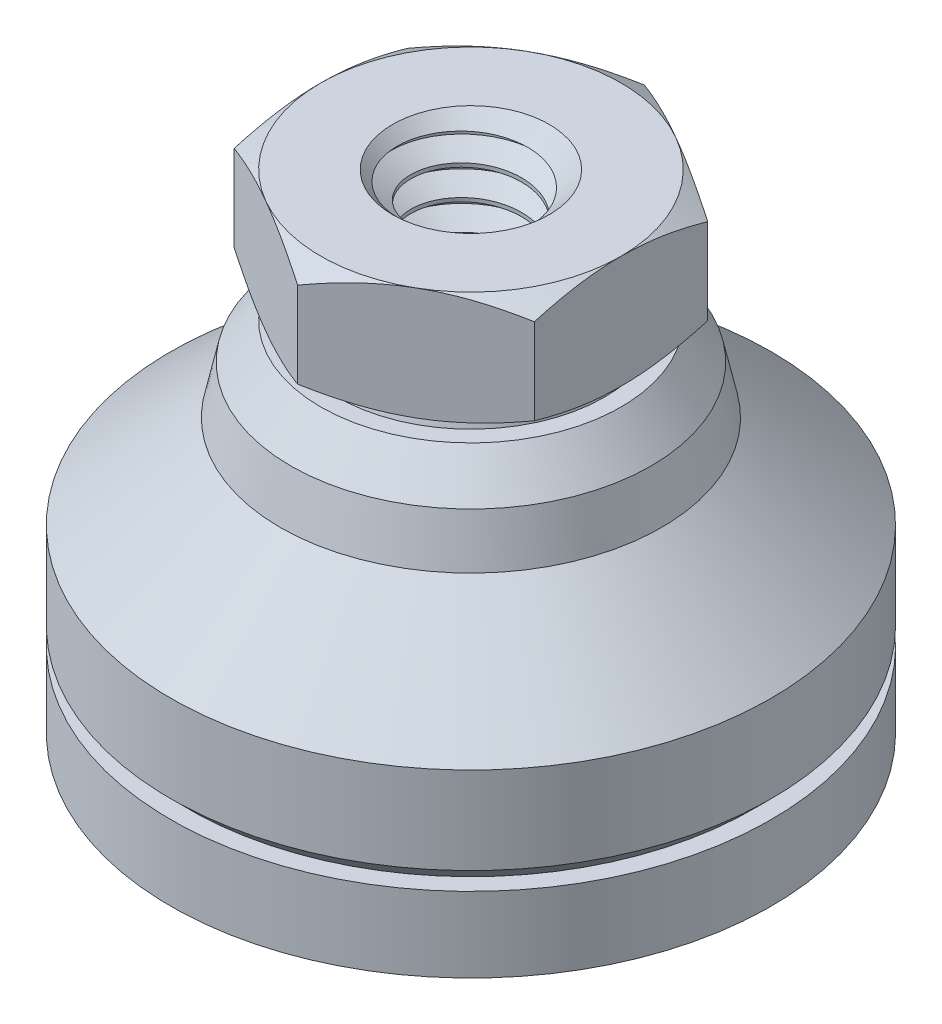
from build123d import *

# Parameters (mm, degrees)
BOSS_EXTRUDE1_DEPTH          = 4.7625
SKETCH5_R                    = 3.175
CUT_EXTRUDE1_DEPTH           = 7.9375
SWEEP1_PITCH                 = 1.27
SKETCH8_R                    = 3.312481533
CUT_EXTRUDE2_OTHER_WAY_DEPTH = 26.050327468
CUT_EXTRUDE2_OTHER_WAY_TAPER = -45
SKETCH11_W                   = 12.7
SKETCH11_H                   = 3.175


with BuildPart() as part:
    # Sketch2 → Revolve1 (revolve)
    with BuildSketch(Plane.XY, mode=Mode.PRIVATE) as revolve1_sk:
        with BuildLine():
            Line((0, 3.175), (0, 7.747))
            ThreePointArc((0, 7.747), (-4.638543521, 10.037538611), (-5.639715241, 15.113))
            Line((-5.639715241, 15.113), (-6.35, 15.113))
            Line((-6.35, 15.113), (-7.62, 13.589))
            Line((-7.62, 13.589), (-8.0645, 11.557))
            Line((-8.0645, 11.557), (-12.7, 7.62))
            Line((-12.7, 7.62), (-12.7, 3.937))
            Line((-12.7, 3.937), (-11.938, 3.175))
            Line((-11.938, 3.175), (0, 3.175))
        make_face()
    revolve(revolve1_sk.sketch.rotate(Axis((0, 0, 0), (0, 1, 0)), 270), axis=Axis((0, 0, 0), (0, 1, 0)))


with BuildPart() as body_2:
    # Sketch10 → Revolve2 (revolve)
    with BuildSketch(Plane.XY):
        with BuildLine():
            Line((0, 15.875), (-5.376166664, 15.875))
            ThreePointArc((-5.376166664, 15.875), (-4.872564828, 10.366101305), (0, 7.747))
            Line((0, 7.747), (0, 15.875))
        make_face()
    revolve(axis=Axis((0, 7.747, 0), (0, 1, 0)))

    # Sketch3 → Boss-Extrude1 (add)
    with BuildSketch(Plane(origin=(0, 15.875, 0), x_dir=(1, 0, 0), z_dir=(0, 1, 0))):
        Polygon((0, 7.332348419), (-6.35, 3.666174209), (-6.35, -3.666174209), (0, -7.332348419), (6.35, -3.666174209), (6.35, 3.666174209), align=None)
    extrude(amount=BOSS_EXTRUDE1_DEPTH)

    # Sketch4 → Cut-Revolve2 (revolve, cut)
    with BuildSketch(Plane(origin=(0, 0, 0), x_dir=(0, 0, -1), z_dir=(1, 0, 0)), mode=Mode.PRIVATE) as cut_revolve2_sk:
        Polygon((-8.314696837, 20.6375), (-8.314696837, 15.875), (-6.35, 15.875), (-7.332348419, 16.442159124), (-7.332348419, 20.070340876), (-6.35, 20.6375), align=None)
    revolve(cut_revolve2_sk.sketch.rotate(Axis((0, 0, 0), (0, 1, 0)), 270), axis=Axis((0, 0, 0), (0, 1, 0)), mode=Mode.SUBTRACT)

    # Sketch5 → Cut-Extrude1 (cut)
    with BuildSketch(Plane(origin=(0, 20.6375, 0), x_dir=(1, 0, 0), z_dir=(0, 1, 0))):
        with Locations(Location((0, 0, 0), (0, 0, 270))):
            Circle(SKETCH5_R)
    extrude(amount=-CUT_EXTRUDE1_DEPTH, mode=Mode.SUBTRACT)

    # Sweep1: the profile of Sketch7 screwed along a right-hand helix of 7.25 turns, 8 arcs to a turn; built about Z, then put on its axis
    sweep1_z = Axis((0, 0, 0), (0, 0, 1))
    sweep1_corners = [(3.243740766, 0, -1.1509375), (2.350110803, 0, -0.635), (2.350110803, 0, -0.47625), (3.243740766, 0, 0.0396875)]
    with BuildLine(mode=Mode.PRIVATE) as sweep1_profile:
        Line(sweep1_corners[0], sweep1_corners[1])
        Line(sweep1_corners[1], sweep1_corners[2])
        Line(sweep1_corners[2], sweep1_corners[3])
        Line(sweep1_corners[3], sweep1_corners[0])
    sweep1_cap = Face(sweep1_profile.wire())
    sweep1_turn_angles = [0, 22.5, 45, 67.5, 90, 112.5, 135, 157.5, 180, 202.5, 225, 247.5, 270, 292.5, 315, 337.5, 360]
    sweep1_turn_weights = [1, 0.9238795325112867, 1, 0.9238795325112867, 1, 0.9238795325112867, 1, 0.9238795325112867, 1, 0.9238795325112867, 1, 0.9238795325112867, 1, 0.9238795325112867, 1, 0.9238795325112867, 1]
    sweep1_turn_rails = [Edge.make_bspline([Vector(p[0], p[1], 0).rotate(sweep1_z, sweep1_turn_angles[k]) / sweep1_turn_weights[k] + Vector(0, 0, p[2] + SWEEP1_PITCH * sweep1_turn_angles[k] / 360) for k in range(17)], [0, 0, 0, 1, 1, 2, 2, 3, 3, 4, 4, 5, 5, 6, 6, 7, 7, 8, 8, 8], 2, sweep1_turn_weights) for p in sweep1_corners]
    sweep1_turn_sides = [Face.make_surface_from_curves(sweep1_turn_rails[p[0]], sweep1_turn_rails[p[1]]) for p in [(0, 1), (1, 2), (2, 3), (3, 0)]]
    sweep1_last_angles = [2520, 2542.5, 2565, 2587.5, 2610]
    sweep1_last_weights = [1, 0.9238795325112867, 1, 0.9238795325112701, 1]
    sweep1_last_rails = [Edge.make_bspline([Vector(p[0], p[1], 0).rotate(sweep1_z, sweep1_last_angles[k]) / sweep1_last_weights[k] + Vector(0, 0, p[2] + SWEEP1_PITCH * sweep1_last_angles[k] / 360) for k in range(5)], [0, 0, 0, 1, 1, 2, 2, 2], 2, sweep1_last_weights) for p in sweep1_corners]
    sweep1_last_sides = [Face.make_surface_from_curves(sweep1_last_rails[p[0]], sweep1_last_rails[p[1]]) for p in [(0, 1), (1, 2), (2, 3), (3, 0)]]
    sweep1 = Plane(origin=(0, 20.6375, 0), x_dir=(1, 0, 0), z_dir=(0, -1, 0)) * Solid(Shell([*[p.moved(Location((0, 0, SWEEP1_PITCH * i))) for i in range(7) for p in sweep1_turn_sides], *sweep1_last_sides, sweep1_cap, sweep1_cap.rotate(sweep1_z, 2610).moved(Location((0, 0, SWEEP1_PITCH * 2610 / 360)))]))
    add(sweep1)

    # Cut-Extrude2 cone 1 section (through the dimple's axis) → Cut-Extrude2 (revolve, cut)
    with BuildSketch(Plane(origin=(0, 20.6375, 0), x_dir=(0, 0, 1), z_dir=(1, 0, 0))):
        Polygon((0, 0), (3.312481533, 0), (0, 3.312481533), align=None)
    revolve(axis=Axis((0, 20.6375, 0), (0, -1, 0)), mode=Mode.SUBTRACT)

    # Sketch8 → Cut-Extrude2 other way (cut)
    with BuildSketch(Plane(origin=(0, 20.6375, 0), x_dir=(1, 0, 0), z_dir=(0, 1, 0))):
        Circle(SKETCH8_R)
    extrude(amount=CUT_EXTRUDE2_OTHER_WAY_DEPTH, taper=CUT_EXTRUDE2_OTHER_WAY_TAPER, mode=Mode.SUBTRACT)


with BuildPart() as body_3:
    # Sketch11 → Revolve3 (revolve)
    with BuildSketch(Plane.XY, mode=Mode.PRIVATE) as revolve3_sk:
        with Locations((6.35, 1.5875)):
            Rectangle(SKETCH11_W, SKETCH11_H)
    revolve(revolve3_sk.sketch.rotate(Axis((0, 0, 0), (0, 1, 0)), 270), axis=Axis((0, 0, 0), (0, 1, 0)))


solid = Compound([part.part, body_2.part, body_3.part])
